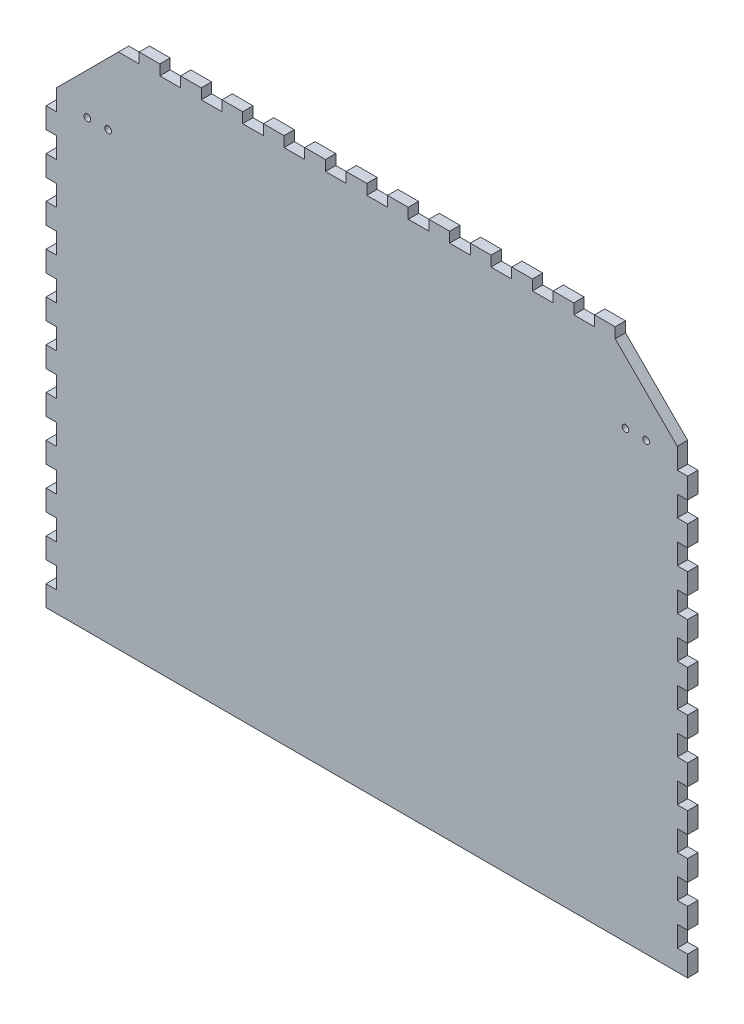
from build123d import *

# Parameters (mm, degrees)
SKIZZE1_R                       = 1.6
AUFSATZ_LINEAR_AUSTRAGEN1_DEPTH = 5


with BuildPart() as part:
    # Skizze1 → Aufsatz-Linear austragen1 (new body)
    with BuildSketch(Plane.XY):
        Polygon((5, 10), (5, 20), (0, 20), (0, 30), (5, 30), (5, 40), (0, 40), (0, 50), (5, 50), (5, 60), (0, 60), (0, 70), (5, 70), (5, 80), (0, 80), (0, 90), (5, 90), (5, 100), (0, 100), (0, 110), (5, 110), (5, 120), (0, 120), (0, 130), (5, 130), (5, 140), (0, 140), (0, 150), (5, 150), (5, 160), (0, 160), (0, 170), (5, 170), (5, 180), (0, 180), (0, 190), (5, 190), (5, 200), (0, 200), (0, 210), (5, 210), (5, 220), (35, 250), (45, 250), (45, 255), (55, 255), (55, 250), (65, 250), (65, 255), (75, 255), (75, 250), (85, 250), (85, 255), (95, 255), (95, 250), (105, 250), (105, 255), (115, 255), (115, 250), (125, 250), (125, 255), (135, 255), (135, 250), (145, 250), (145, 255), (155, 255), (155, 250), (165, 250), (165, 255), (175, 255), (175, 250), (185, 250), (185, 255), (195, 255), (195, 250), (205, 250), (205, 255), (215, 255), (215, 250), (225, 250), (225, 255), (235, 255), (235, 250), (245, 250), (245, 255), (255, 255), (255, 250), (265, 250), (265, 255), (275, 255), (275, 250), (305, 220), (305, 210), (310, 210), (310, 200), (305, 200), (305, 190), (310, 190), (310, 180), (305, 180), (305, 170), (310, 170), (310, 160), (305, 160), (305, 150), (310, 150), (310, 140), (305, 140), (305, 130), (310, 130), (310, 120), (305, 120), (305, 110), (310, 110), (310, 100), (305, 100), (305, 90), (310, 90), (310, 80), (305, 80), (305, 70), (310, 70), (310, 60), (305, 60), (305, 50), (310, 50), (310, 40), (305, 40), (305, 30), (310, 30), (310, 20), (305, 20), (305, 10), (310, 10), (310, 0), (305, 0), (5, 0), (0, 0), (0, 10), align=None)
        with Locations((20, 215)):
            Circle(SKIZZE1_R, mode=Mode.SUBTRACT)
        with Locations((30, 215)):
            Circle(SKIZZE1_R, mode=Mode.SUBTRACT)
        with Locations((290, 215)):
            Circle(SKIZZE1_R, mode=Mode.SUBTRACT)
        with Locations((280, 215)):
            Circle(SKIZZE1_R, mode=Mode.SUBTRACT)
    extrude(amount=AUFSATZ_LINEAR_AUSTRAGEN1_DEPTH)


solid = part.part
